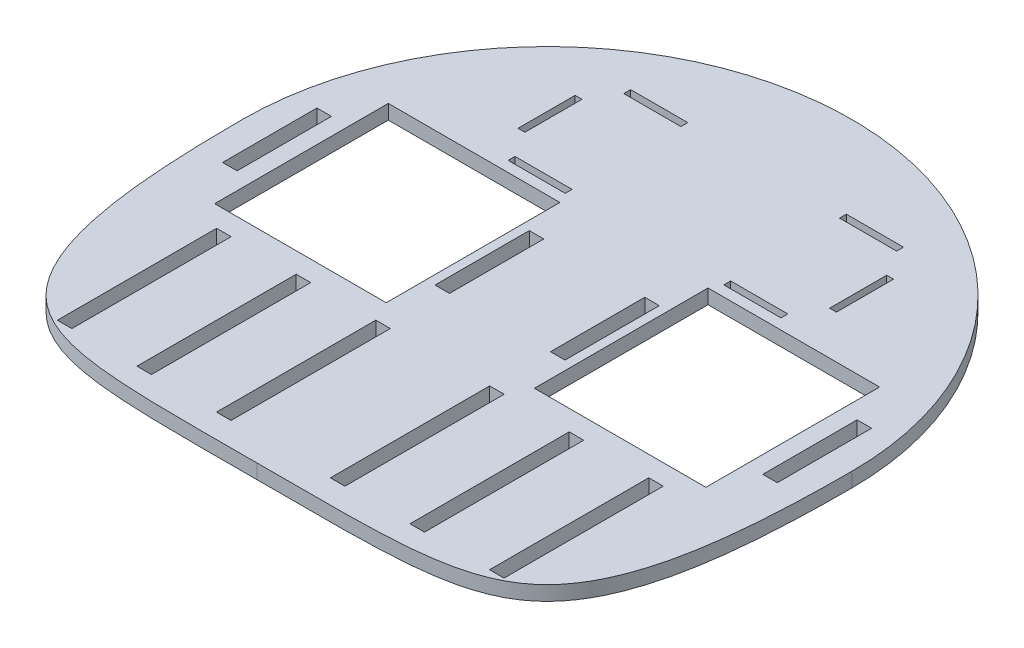
from build123d import *

# Parameters (mm, degrees)
BASE_DEPTH          = 6.35
SKETCH6_W           = 75.0815
SKETCH6_H           = 76
SKETCH6_W_2         = 6.35
SKETCH6_H_2         = 41.275
WHEELSHAFTCUT_DEPTH = 189.692256213
SKETCH8_W           = 6.35
SKETCH8_H           = 69.7
CUT_EXTRUDE3_DEPTH  = 189.692256213
SKETCH10_W          = 25
SKETCH10_H          = 3
SKETCH10_W_2        = 3
SKETCH10_H_2        = 25
CUT_EXTRUDE4_DEPTH  = 189.692256213


with BuildPart() as part:
    # Sketch1 → Base (new body)
    with BuildSketch(Plane(origin=(0, 0, 0), x_dir=(1, 0, 0), z_dir=(0, 1, 0))):
        with BuildLine():
            ThreePointArc((133.35, 0), (0, 133.35), (-133.35, 0))
            add(Edge.make_bspline(
                [(-133.35, 0), (-133.35, -51.197979728), (-123.803376308, -129.805052089), (-58.427993604, -127), (0, -127)],
                knots=[0, 0, 0, 0, 0.502616309, 1, 1, 1, 1], degree=3))
            add(Edge.make_bspline(
                [(133.35, 0), (133.35, -51.197979728), (123.803376308, -129.805052089), (58.427993604, -127), (0, -127)],
                knots=[0, 0, 0, 0, 0.502616309, 1, 1, 1, 1], degree=3))
        make_face()
    extrude(amount=BASE_DEPTH)

    # Sketch6 → WheelShaftCut (cut, through all)
    with BuildSketch(Plane(origin=(0, 6.35, 0), x_dir=(1, 0, 0), z_dir=(0, 1, 0))):
        with Locations((-69.957348141, 0)):
            Rectangle(SKETCH6_W, SKETCH6_H)
        with Locations((-118.197848141, 0)):
            Rectangle(SKETCH6_W_2, SKETCH6_H_2)
        with Locations((-25.272848141, 0)):
            Rectangle(SKETCH6_W_2, SKETCH6_H_2)
        with Locations((25.272848141, 0)):
            Rectangle(SKETCH6_W_2, SKETCH6_H_2)
        with Locations((118.197848141, 0)):
            Rectangle(SKETCH6_W_2, SKETCH6_H_2)
        with Locations((69.957348141, 0)):
            Rectangle(SKETCH6_W, SKETCH6_H)
    extrude(amount=-WHEELSHAFTCUT_DEPTH, mode=Mode.SUBTRACT)

    # Sketch8 → Cut-Extrude3 (cut, through all)
    with BuildSketch(Plane(origin=(0, 6.35, 0), x_dir=(1, 0, 0), z_dir=(0, 1, 0))):
        with Locations((-24.910348141, -81.74)):
            Rectangle(SKETCH8_W, SKETCH8_H)
        with Locations((-59.735348141, -81.74)):
            Rectangle(SKETCH8_W, SKETCH8_H)
        with Locations((-94.560348141, -81.74)):
            Rectangle(SKETCH8_W, SKETCH8_H)
        with Locations((94.560348141, -81.74)):
            Rectangle(SKETCH8_W, SKETCH8_H)
        with Locations((59.735348141, -81.74)):
            Rectangle(SKETCH8_W, SKETCH8_H)
        with Locations((24.910348141, -81.74)):
            Rectangle(SKETCH8_W, SKETCH8_H)
    extrude(amount=-CUT_EXTRUDE3_DEPTH, mode=Mode.SUBTRACT)

    # Sketch10 → Cut-Extrude4 (cut, through all)
    with BuildSketch(Plane(origin=(0, 6.35, 0), x_dir=(1, 0, 0), z_dir=(0, 1, 0))):
        with Locations((-47.19, 44.12)):
            Rectangle(SKETCH10_W, SKETCH10_H)
        with Locations((-47.19, 94.745)):
            Rectangle(SKETCH10_W, SKETCH10_H)
        with Locations((-68.175, 69.4325)):
            Rectangle(SKETCH10_W_2, SKETCH10_H_2)
        with Locations((68.175, 69.4325)):
            Rectangle(SKETCH10_W_2, SKETCH10_H_2)
        with Locations((47.19, 94.745)):
            Rectangle(SKETCH10_W, SKETCH10_H)
        with Locations((47.19, 44.12)):
            Rectangle(SKETCH10_W, SKETCH10_H)
    extrude(amount=-CUT_EXTRUDE4_DEPTH, mode=Mode.SUBTRACT)


solid = part.part
